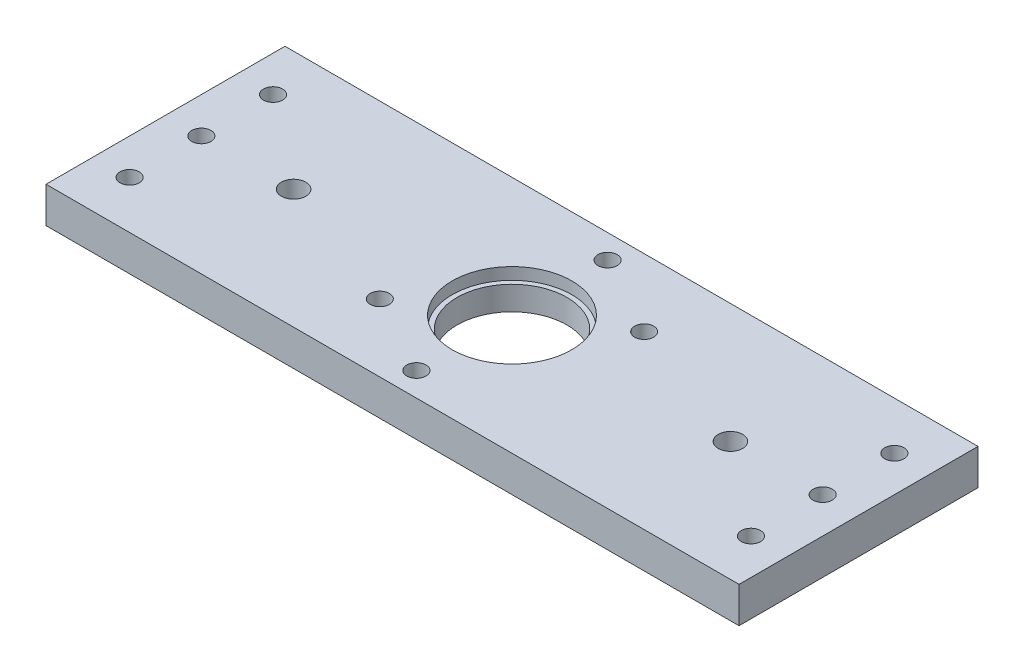
from build123d import *

# Parameters (mm, degrees)
SKETCH1_W                  = 184.15
SKETCH1_H                  = 63.5
BOSS_EXTRUDE1_DEPTH        = 9.525
SKETCH3_R                  = 14.605
CUT_EXTRUDE1_DEPTH         = 98.860072297
F_10_CLEARANCE_HOLE1_D     = 5.1054
F_6_5_6_5_DIAMETER_HOLE3_D = 6.5
SKETCH29_R                 = 15.875
CUT_EXTRUDE5_DEPTH         = 3.175
F_10_CLEARANCE_HOLE2_D     = 5.1054
SKETCH36_R                 = 2.54
CUT_EXTRUDE6_DEPTH         = 98.860072297


with BuildPart() as part:
    # Sketch1 → Boss-Extrude1 (new body)
    with BuildSketch(Plane(origin=(0, 0, 0), x_dir=(1, 0, 0), z_dir=(0, 1, 0))):
        Rectangle(SKETCH1_W, SKETCH1_H)
    extrude(amount=BOSS_EXTRUDE1_DEPTH)

    # Sketch3 → Cut-Extrude1 (cut, through all)
    with BuildSketch(Plane(origin=(0, 9.525, 0), x_dir=(1, 0, 0), z_dir=(0, 1, 0))):
        Circle(SKETCH3_R)
    extrude(amount=-CUT_EXTRUDE1_DEPTH, mode=Mode.SUBTRACT)

    # #10 Clearance Hole1 (through all)
    with Locations(Plane(origin=(0, 0, 0), x_dir=(-1, 0, 0), z_dir=(0, -1, 0))):
        with Locations((0, -25.4), (0, 25.4)):
            Hole(F_10_CLEARANCE_HOLE1_D / 2)

    # Ø6.5 (6.5) Diameter Hole3 (through all)
    with Locations(Plane(origin=(0, 0, 0), x_dir=(-1, 0, 0), z_dir=(0, -1, 0))):
        with Locations((58.039, 0), (-58.039, 0)):
            Hole(F_6_5_6_5_DIAMETER_HOLE3_D / 2)

    # Sketch29 → Cut-Extrude5 (cut)
    with BuildSketch(Plane(origin=(0, 9.525, 0), x_dir=(1, 0, 0), z_dir=(0, 1, 0))):
        Circle(SKETCH29_R)
    extrude(amount=-CUT_EXTRUDE5_DEPTH, mode=Mode.SUBTRACT)

    # #10 Clearance Hole2 (through all)
    with Locations(Plane(origin=(0, 9.525, 0), x_dir=(1, 0, 0), z_dir=(0, 1, 0))):
        with Locations((-82.55, 19.05), (-82.55, -19.05), (82.55, -19.05), (82.55, 19.05), (-82.55, 0), (82.55, 0)):
            Hole(F_10_CLEARANCE_HOLE2_D / 2)

    # Sketch36 → Cut-Extrude6 (cut, through all)
    with BuildSketch(Plane.XZ):
        with Locations((-21.329210467, 13.7922)):
            Circle(SKETCH36_R)
        with Locations((21.329210467, -13.7922)):
            Circle(SKETCH36_R)
    extrude(amount=-CUT_EXTRUDE6_DEPTH, mode=Mode.SUBTRACT)


solid = part.part
